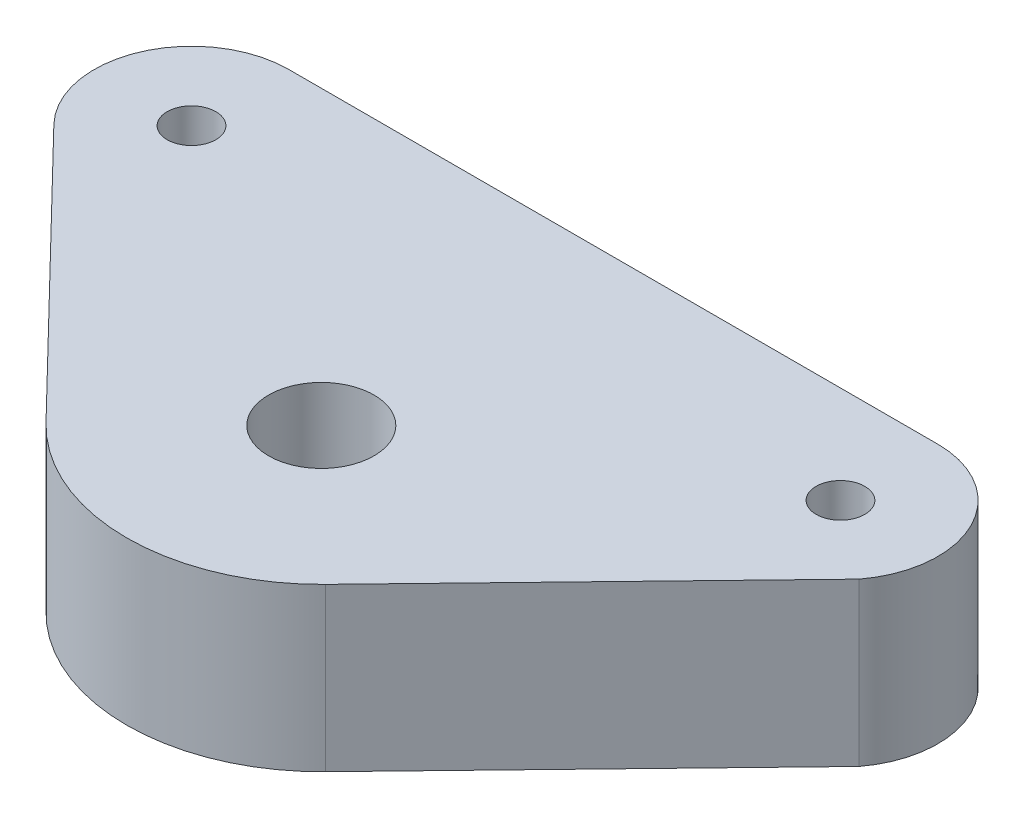
from build123d import *

# Parameters (mm, degrees)
BOSS_EXTRUDE1_OUTLINE_R = 1.5
BOSS_EXTRUDE1_DEPTH     = 10
SKETCH3_R               = 3.25
CUT_EXTRUDE1_DEPTH      = 5
SKETCH4_R               = 3.25
CUT_EXTRUDE2_DEPTH      = 5


# Read off the part's stored shape, not the designer's step: Boss-Extrude1
with BuildPart() as part:
    # Boss-Extrude1 outline → Boss-Extrude1 (new body)
    with BuildSketch(Plane(origin=(0, 0, 0), x_dir=(1, 0, 0), z_dir=(0, 1, 0))):
        with BuildLine():
            ThreePointArc((-20, 18), (-25.525673356, 14.33814755), (-24.306613207, 7.822311322))
            Line((-24.306613207, 7.822311322), (-8.613226413, -8.355377356))
            ThreePointArc((-8.613226413, -8.355377356), (0, -12), (8.613226413, -8.355377356))
            Line((8.613226413, -8.355377356), (24.778677898, 8.371744559))
            ThreePointArc((24.778677898, 8.371744559), (25.374454979, 14.667439536), (20, 18))
            Line((20, 18), (-20, 18))
        make_face()
        Circle(BOSS_EXTRUDE1_OUTLINE_R, mode=Mode.SUBTRACT)
        with Locations((-20, 12)):
            Circle(BOSS_EXTRUDE1_OUTLINE_R, mode=Mode.SUBTRACT)
        with Locations((20, 12)):
            Circle(BOSS_EXTRUDE1_OUTLINE_R, mode=Mode.SUBTRACT)
    extrude(amount=BOSS_EXTRUDE1_DEPTH)

    # Sketch3 → Cut-Extrude1 (cut)
    with BuildSketch(Plane(origin=(0, 10, 0), x_dir=(1, 0, 0), z_dir=(0, 1, 0))):
        with Locations(Location((0, 0, 0), (0, 0, 270))):
            Circle(SKETCH3_R)
    extrude(amount=-CUT_EXTRUDE1_DEPTH, mode=Mode.SUBTRACT)

    # Sketch4 → Cut-Extrude2 (cut)
    with BuildSketch(Plane.XZ):
        with Locations(Location((20, -12, 0), (0, 0, 270))):
            Circle(SKETCH4_R)
        with Locations(Location((-20, -12, 0), (0, 0, 270))):
            Circle(SKETCH4_R)
    extrude(amount=-CUT_EXTRUDE2_DEPTH, mode=Mode.SUBTRACT)


solid = part.part
